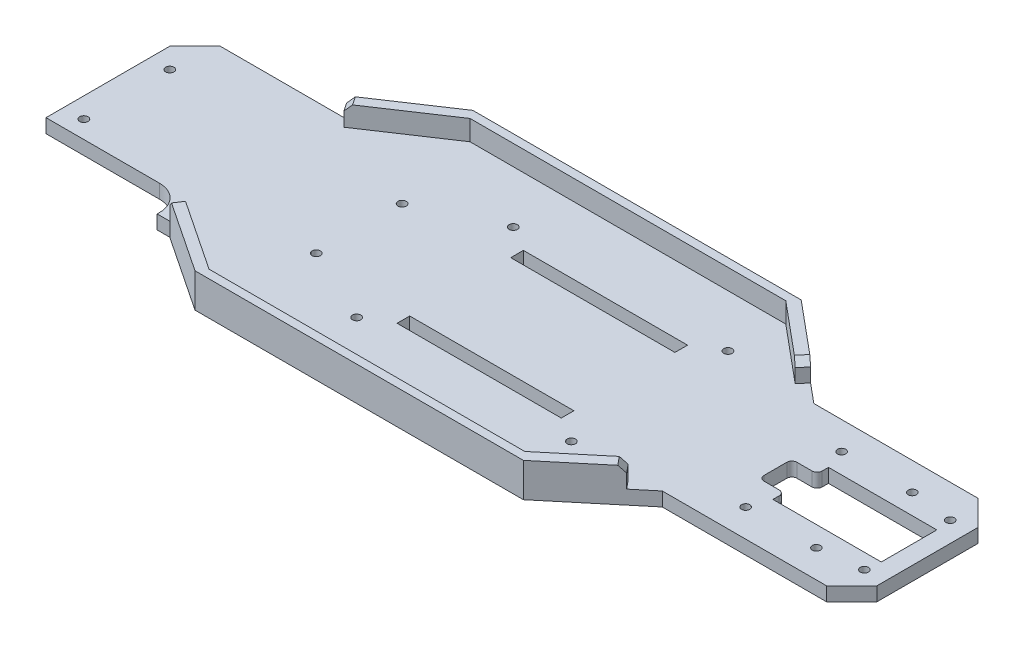
from build123d import *

# Parameters (mm, degrees)
BOSS_EXTRUDE1_DEPTH      = 5.5
CHASSIS_WALLS1_DEPTH     = 8
CHAMFER1_SIZE            = 10
CHAMFER2_SIZE            = 10
CHAMFER3_SIZE            = 2.5
SKETCH4_R                = 1.65
CUT_EXTRUDE1_DEPTH       = 10
SKETCH5_W                = 55
SKETCH5_H                = 11
CUT_EXTRUDE2_DEPTH       = 10
SKETCH6_W                = 65
SKETCH6_H                = 5
CUT_EXTRUDE3_DEPTH       = 179.854689623
FILLET1_R                = 10
SKETCH7_W                = 42.9
SKETCH7_H                = 22
CUT_EXTRUDE4_DEPTH       = 179.854689623
SKETCH9_R                = 1.625
CUT_EXTRUDE5_DEPTH       = 179.854689623
SKETCH10_W               = 10
SKETCH10_H               = 13
SERVO_CABLE_CUTOUT_DEPTH = 10
FILLET2_R                = 2


with BuildPart() as part:
    # Sketch1 → Boss-Extrude1 (new body)
    with BuildSketch(Plane(origin=(0, 0, 0), x_dir=(1, 0, 0), z_dir=(0, 1, 0))):
        Polygon((-95, 35), (-65, 55), (65, 55), (95, 30), (170, 30), (170, -30), (95, -30), (65, -55), (-65, -55), (-95, -35), (-155, -35), (-155, 35), align=None)
    extrude(amount=BOSS_EXTRUDE1_DEPTH)

    # Sketch3 → Chassis-Walls1 (add)
    with BuildSketch(Plane(origin=(0, 5.5, 0), x_dir=(1, 0, 0), z_dir=(0, 1, 0))):
        Polygon((0, 55), (-65, 55), (-95, 35), (-92.781199215, 31.671798823), (-62.781199215, 51.671798823), (0, 51.671798823), (62.226499019, 51.671798823), (84.544286223, 33.073642819), (87.317787204, 36.401843997), (65, 55), align=None)
        Polygon((62.226499019, -51.671798823), (0, -51.671798823), (-62.781199215, -51.671798823), (-92.781199215, -31.671798823), (-95, -35), (-65, -55), (0, -55), (65, -55), (87.317787204, -36.401843997), (84.544286223, -33.073642819), align=None)
    extrude(amount=CHASSIS_WALLS1_DEPTH)

    # Chamfer1
    chamfer1_edges = [part.edges().sort_by_distance(p)[0] for p in [
        (-155, 2.75, -35),
        (-155, 2.75, 35),
    ]]
    chamfer(chamfer1_edges, length=CHAMFER1_SIZE)

    # Chamfer2
    chamfer2_edges = [part.edges().sort_by_distance(p)[0] for p in [
        (170, 2.75, -30),
        (170, 2.75, 30),
    ]]
    chamfer(chamfer2_edges, length=CHAMFER2_SIZE)

    # Chamfer3
    chamfer3_edges = [part.edges().sort_by_distance(p)[0] for p in [
        (-93.890599608, 13.5, -33.335899411),
        (85.931036713, 13.5, -34.737743408),
        (-93.890599608, 13.5, 33.335899411),
        (85.931036713, 13.5, 34.737743408),
    ]]
    chamfer(chamfer3_edges, length=CHAMFER3_SIZE)

    # Sketch4 → Cut-Extrude1 (cut)
    with BuildSketch(Plane.XZ):
        with Locations((-147, 17)):
            Circle(SKETCH4_R)
        with Locations((-55, 17)):
            Circle(SKETCH4_R)
        with Locations((-55, -17)):
            Circle(SKETCH4_R)
        with Locations((-147, -17)):
            Circle(SKETCH4_R)
        with Locations((-25, 31)):
            Circle(SKETCH4_R)
        with Locations((60, 31)):
            Circle(SKETCH4_R)
        with Locations((60, -31)):
            Circle(SKETCH4_R)
        with Locations((-25, -31)):
            Circle(SKETCH4_R)
    extrude(amount=-CUT_EXTRUDE1_DEPTH, mode=Mode.SUBTRACT)

    # Sketch5 → Cut-Extrude2 (cut)
    with BuildSketch(Plane(origin=(0, 5.5, 0), x_dir=(1, 0, 0), z_dir=(0, 1, 0))):
        with Locations((-127.5, -29.5)):
            Rectangle(SKETCH5_W, SKETCH5_H)
    extrude(amount=-CUT_EXTRUDE2_DEPTH, mode=Mode.SUBTRACT)

    # Sketch6 → Cut-Extrude3 (cut, through all)
    with BuildSketch(Plane(origin=(0, 5.5, 0), x_dir=(1, 0, 0), z_dir=(0, 1, 0))):
        with Locations((17.5, 22.5)):
            Rectangle(SKETCH6_W, SKETCH6_H)
        with Locations((17.5, -22.5)):
            Rectangle(SKETCH6_W, SKETCH6_H)
    extrude(amount=-CUT_EXTRUDE3_DEPTH, mode=Mode.SUBTRACT)

    # Fillet1
    fillet1_edges = [part.edges().sort_by_distance(p)[0] for p in [
        (-100, 2.75, 24),
    ]]
    fillet(fillet1_edges, radius=FILLET1_R)

    # Sketch7 → Cut-Extrude4 (cut, through all)
    with BuildSketch(Plane(origin=(0, 5.5, 0), x_dir=(1, 0, 0), z_dir=(0, 1, 0))):
        with Locations((141.25, 0)):
            Rectangle(SKETCH7_W, SKETCH7_H)
    extrude(amount=-CUT_EXTRUDE4_DEPTH, mode=Mode.SUBTRACT)

    # Sketch9 → Cut-Extrude5 (cut, through all)
    with BuildSketch(Plane(origin=(0, 5.5, 0), x_dir=(1, 0, 0), z_dir=(0, 1, 0))):
        with Locations((117, -19)):
            Circle(SKETCH9_R)
        with Locations((145, -19)):
            Circle(SKETCH9_R)
        with Locations((162, -17)):
            Circle(SKETCH9_R)
    cut_extrude5 = extrude(amount=-CUT_EXTRUDE5_DEPTH, mode=Mode.SUBTRACT)

    # Mirror1: Cut-Extrude5 across plane
    add(cut_extrude5.mirror(Plane.XY), mode=Mode.SUBTRACT)

    # Sketch10 → Servo-Cable-Cutout (cut)
    with BuildSketch(Plane(origin=(0, 5.5, 0), x_dir=(1, 0, 0), z_dir=(0, 1, 0))):
        with Locations((114.8, 0)):
            Rectangle(SKETCH10_W, SKETCH10_H)
    extrude(amount=-SERVO_CABLE_CUTOUT_DEPTH, mode=Mode.SUBTRACT)

    # Fillet2
    fillet2_edges = [part.edges().sort_by_distance(p)[0] for p in [
        (119.8, 2.75, -6.5),
        (119.8, 2.75, 6.5),
        (109.8, 2.75, 6.5),
        (109.8, 2.75, -6.5),
    ]]
    fillet(fillet2_edges, radius=FILLET2_R)


solid = part.part
